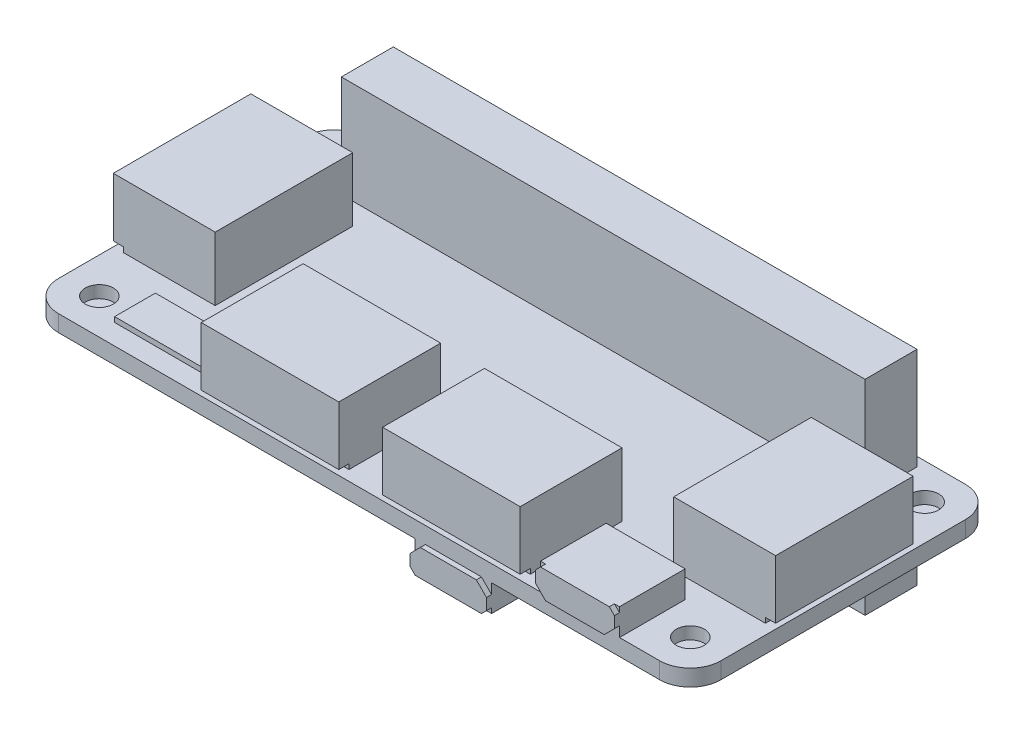
from build123d import *

# Parameters (mm, degrees)
EXTRUDE_1_DEPTH     = 1.62
SKETCH_2_R          = 1.375
CUT_EXTRUDE_1_DEPTH = 1.2
SKETCH_11_W         = 51.4
SKETCH_11_H         = 5.1
EXTRUDE_9_DEPTH     = 8.45
SKETCH_12_W         = 51.4
SKETCH_12_H         = 5.1
EXTRUDE_10_DEPTH    = 10
SKETCH_13_W         = 10
SKETCH_13_H         = 13.5
SKETCH_13_W_2       = 13.5
SKETCH_13_H_2       = 10
EXTRUDE_12_DEPTH    = 6.25
SKETCH_14_W         = 13.5
SKETCH_14_H         = 0.5
CUT_EXTRUDE_2_DEPTH = 1
SKETCH_15_W         = 13.5
SKETCH_15_H         = 0.5
CUT_EXTRUDE_3_DEPTH = 1
SKETCH_16_W         = 13.5
SKETCH_16_H         = 0.5
CUT_EXTRUDE_4_DEPTH = 1
SKETCH_17_W         = 7.75
SKETCH_17_H         = 6.44
EXTRUDE_13_DEPTH    = 2.62
EXTRUDE_14_DEPTH    = 0.5
SKETCH_19_W         = 8.5
SKETCH_19_H         = 4
EXTRUDE_15_DEPTH    = 0.5
SKETCH_20_W         = 7.5
SKETCH_20_H         = 5.146384945
EXTRUDE_16_DEPTH    = 2.62
EXTRUDE_17_DEPTH    = 0.5


with BuildPart() as part:
    # 草图1 → 凸台-拉伸1 (new body)
    with BuildSketch(Plane(origin=(0, 0, 0), x_dir=(1, 0, 0), z_dir=(0, 1, 0))):
        with BuildLine():
            Line((-29.5, 15), (29.5, 15))
            ThreePointArc((29.5, 15), (31.621320344, 14.121320344), (32.5, 12))
            Line((32.5, 12), (32.5, -12))
            ThreePointArc((32.5, -12), (31.621320344, -14.121320344), (29.5, -15))
            Line((29.5, -15), (-29.5, -15))
            ThreePointArc((-29.5, -15), (-31.621320344, -14.121320344), (-32.5, -12))
            Line((-32.5, -12), (-32.5, 12))
            ThreePointArc((-32.5, 12), (-31.621320344, 14.121320344), (-29.5, 15))
        make_face()
    extrude(amount=EXTRUDE_1_DEPTH)

    # 草图2 → 切除-拉伸1 (cut)
    with BuildSketch(Plane(origin=(0, 1.62, 0), x_dir=(1, 0, 0), z_dir=(0, 1, 0))):
        with Locations((29, -11.5)):
            Circle(SKETCH_2_R)
        with Locations((29, 11.5)):
            Circle(SKETCH_2_R)
        with Locations((-29, -11.5)):
            Circle(SKETCH_2_R)
        with Locations((-29, 11.5)):
            Circle(SKETCH_2_R)
    extrude(amount=-CUT_EXTRUDE_1_DEPTH, mode=Mode.SUBTRACT)

    # 草图11 → 凸台-拉伸9 (add)
    with BuildSketch(Plane.XZ):
        with Locations((-0.05, -11.55)):
            Rectangle(SKETCH_11_W, SKETCH_11_H)
    extrude(amount=EXTRUDE_9_DEPTH)

    # 草图12 → 凸台-拉伸10 (add)
    with BuildSketch(Plane(origin=(0, 1.62, 0), x_dir=(1, 0, 0), z_dir=(0, 1, 0))):
        with Locations((-0.05, 11.55)):
            Rectangle(SKETCH_12_W, SKETCH_12_H)
    extrude(amount=EXTRUDE_10_DEPTH)

    # 草图13 → 凸台-拉伸12 (add)
    with BuildSketch(Plane(origin=(0, 1.62, 0), x_dir=(1, 0, 0), z_dir=(0, 1, 0))):
        with Locations((-27.5, 0.12)):
            Rectangle(SKETCH_13_W, SKETCH_13_H)
        with Locations((27.5, 0.12)):
            Rectangle(SKETCH_13_W, SKETCH_13_H)
        with Locations((-8.75, -10)):
            Rectangle(SKETCH_13_W_2, SKETCH_13_H_2)
        with Locations((9.05, -10)):
            Rectangle(SKETCH_13_W_2, SKETCH_13_H_2)
    extrude(amount=EXTRUDE_12_DEPTH)

    # 草图14 → 切除-拉伸2 (cut)
    with BuildSketch(Plane.XY.offset(15)):
        with Locations((-8.75, 1.87)):
            Rectangle(SKETCH_14_W, SKETCH_14_H)
        with Locations((9.05, 1.87)):
            Rectangle(SKETCH_14_W, SKETCH_14_H)
    extrude(amount=-CUT_EXTRUDE_2_DEPTH, mode=Mode.SUBTRACT)

    # 草图15 → 切除-拉伸3 (cut)
    with BuildSketch(Plane.ZY.offset(32.5)):
        with Locations((-0.12, 1.87)):
            Rectangle(SKETCH_15_W, SKETCH_15_H)
    extrude(amount=-CUT_EXTRUDE_3_DEPTH, mode=Mode.SUBTRACT)

    # 草图16 → 切除-拉伸4 (cut)
    with BuildSketch(Plane(origin=(32.5, 0, 0), x_dir=(0, 0, -1), z_dir=(1, 0, 0))):
        with Locations((0.12, 1.87)):
            Rectangle(SKETCH_16_W, SKETCH_16_H)
    extrude(amount=-CUT_EXTRUDE_4_DEPTH, mode=Mode.SUBTRACT)

    # 草图17 → 凸台-拉伸13 (add)
    with BuildSketch(Plane(origin=(0, 1.62, 0), x_dir=(1, 0, 0), z_dir=(0, 1, 0))):
        with Locations((21.675, -11.78)):
            Rectangle(SKETCH_17_W, SKETCH_17_H)
    extrude(amount=EXTRUDE_13_DEPTH)

    # 草图18 → 凸台-拉伸14 (add)
    with BuildSketch(Plane.XY.offset(15)):
        Polygon((17.8, 2.62), (18.8, 1.62), (24.55, 1.62), (25.55, 2.62), (25.55, 3.74), (25.05, 4.24), (18.3, 4.24), (17.8, 3.74), align=None)
    extrude(amount=EXTRUDE_14_DEPTH)

    # 草图19 → 凸台-拉伸15 (add)
    with BuildSketch(Plane(origin=(0, 1.62, 0), x_dir=(1, 0, 0), z_dir=(0, 1, 0))):
        with Locations((-21.75, -11)):
            Rectangle(SKETCH_19_W, SKETCH_19_H)
    extrude(amount=EXTRUDE_15_DEPTH)

    # 草图20 → 凸台-拉伸16 (add)
    with BuildSketch(Plane.XZ):
        with Locations((9.25, 12.426807528)):
            Rectangle(SKETCH_20_W, SKETCH_20_H)
    extrude(amount=EXTRUDE_16_DEPTH)

    # 草图21 → 凸台-拉伸17 (add)
    with BuildSketch(Plane.XY.offset(15)):
        Polygon((6.5, 0), (12, 0), (13, -1), (13, -2.12), (12.5, -2.62), (6, -2.62), (5.5, -2.12), (5.5, -1), align=None)
    extrude(amount=EXTRUDE_17_DEPTH)


solid = part.part
